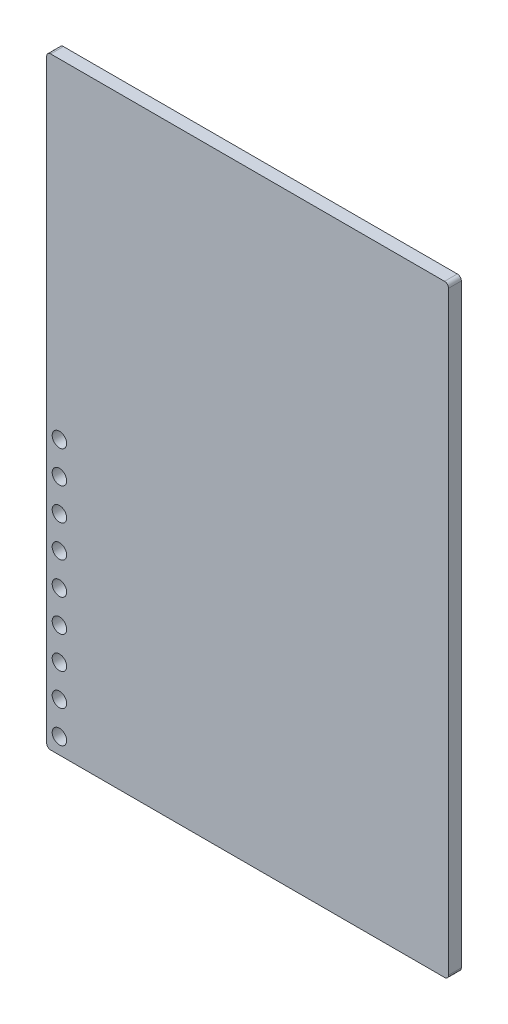
from build123d import *

# Parameters (mm, degrees)
SKETCH1_W           = 100
SKETCH1_H           = 3.175
BOSS_EXTRUDE1_DEPTH = 150
SKETCH2_R           = 1.8
CUT_EXTRUDE2_DEPTH  = 5
SKETCH2_14_R        = 1.8
CUT_EXTRUDE3_DEPTH  = 5
SKETCH2_15_R        = 1.8
CUT_EXTRUDE4_DEPTH  = 5
SKETCH2_16_R        = 1.8
CUT_EXTRUDE5_DEPTH  = 5
SKETCH2_17_R        = 1.8
CUT_EXTRUDE6_DEPTH  = 5
SKETCH2_18_R        = 1.8
CUT_EXTRUDE7_DEPTH  = 5
SKETCH2_19_R        = 1.8
CUT_EXTRUDE8_DEPTH  = 5
SKETCH2_20_R        = 1.8
CUT_EXTRUDE9_DEPTH  = 5
SKETCH2_21_R        = 1.8
CUT_EXTRUDE10_DEPTH = 5
FILLET1_R           = 1


with BuildPart() as part:
    # Sketch1 → Boss-Extrude1 (new body)
    with BuildSketch(Plane(origin=(0, 0, 0), x_dir=(1, 0, 0), z_dir=(0, 1, 0))):
        with Locations((50, 1.5875)):
            Rectangle(SKETCH1_W, SKETCH1_H)
    extrude(amount=BOSS_EXTRUDE1_DEPTH)

    # Sketch2 → Cut-Extrude2 (cut)
    with BuildSketch(Plane.XY):
        with Locations((3.175, 68)):
            Circle(SKETCH2_R)
    extrude(amount=-CUT_EXTRUDE2_DEPTH, mode=Mode.SUBTRACT)

    # Sketch2<14> → Cut-Extrude3 (cut)
    with BuildSketch(Plane.XY):
        with Locations((3.175, 60)):
            Circle(SKETCH2_14_R)
    extrude(amount=-CUT_EXTRUDE3_DEPTH, mode=Mode.SUBTRACT)

    # Sketch2<15> → Cut-Extrude4 (cut)
    with BuildSketch(Plane.XY):
        with Locations((3.175, 52)):
            Circle(SKETCH2_15_R)
    extrude(amount=-CUT_EXTRUDE4_DEPTH, mode=Mode.SUBTRACT)

    # Sketch2<16> → Cut-Extrude5 (cut)
    with BuildSketch(Plane.XY):
        with Locations((3.175, 44)):
            Circle(SKETCH2_16_R)
    extrude(amount=-CUT_EXTRUDE5_DEPTH, mode=Mode.SUBTRACT)

    # Sketch2<17> → Cut-Extrude6 (cut)
    with BuildSketch(Plane.XY):
        with Locations((3.175, 36)):
            Circle(SKETCH2_17_R)
    extrude(amount=-CUT_EXTRUDE6_DEPTH, mode=Mode.SUBTRACT)

    # Sketch2<18> → Cut-Extrude7 (cut)
    with BuildSketch(Plane.XY):
        with Locations((3.175, 28)):
            Circle(SKETCH2_18_R)
    extrude(amount=-CUT_EXTRUDE7_DEPTH, mode=Mode.SUBTRACT)

    # Sketch2<19> → Cut-Extrude8 (cut)
    with BuildSketch(Plane.XY):
        with Locations((3.175, 20)):
            Circle(SKETCH2_19_R)
    extrude(amount=-CUT_EXTRUDE8_DEPTH, mode=Mode.SUBTRACT)

    # Sketch2<20> → Cut-Extrude9 (cut)
    with BuildSketch(Plane.XY):
        with Locations((3.175, 12)):
            Circle(SKETCH2_20_R)
    extrude(amount=-CUT_EXTRUDE9_DEPTH, mode=Mode.SUBTRACT)

    # Sketch2<21> → Cut-Extrude10 (cut)
    with BuildSketch(Plane.XY):
        with Locations((3.175, 4)):
            Circle(SKETCH2_21_R)
    extrude(amount=-CUT_EXTRUDE10_DEPTH, mode=Mode.SUBTRACT)

    # Fillet1
    fillet1_edges = [part.edges().sort_by_distance(p)[0] for p in [
        (0, 0, -1.5875),
        (0, 150, -1.5875),
        (100, 150, -1.5875),
        (100, 0, -1.5875),
    ]]
    fillet(fillet1_edges, radius=FILLET1_R)


solid = part.part
